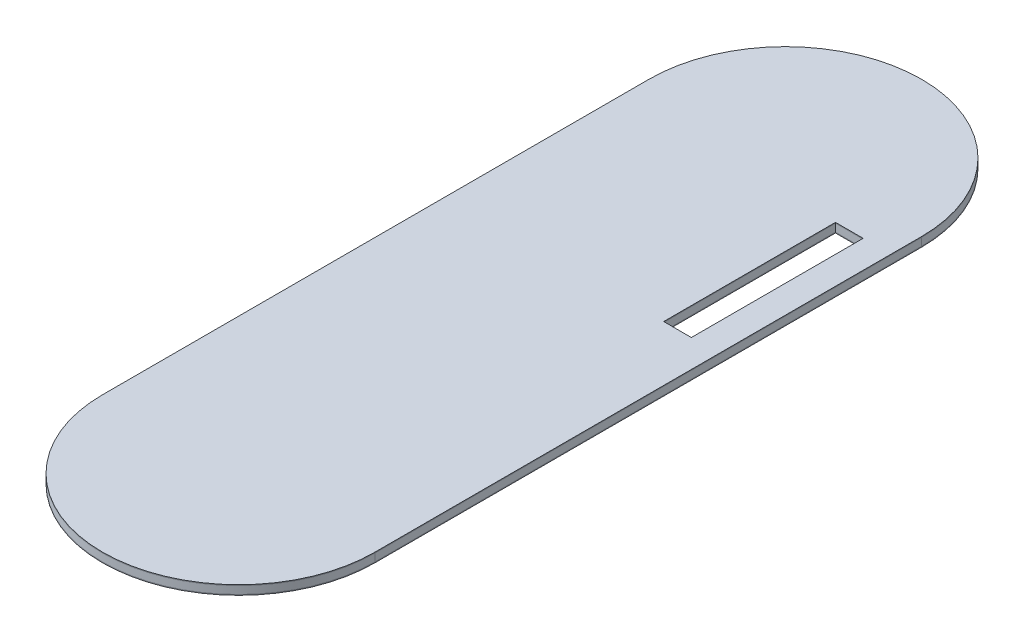
from build123d import *

# Parameters (mm, degrees)
SKETCH1_W           = 9
SKETCH1_H           = 55.88
BOSS_EXTRUDE1_DEPTH = 0.25
SKETCH2_W           = 9
SKETCH2_H           = 55.88
BOSS_EXTRUDE3_DEPTH = 2.5
SKETCH3_W           = 9
SKETCH3_H           = 55.88
BOSS_EXTRUDE4_DEPTH = 0.25


with BuildPart() as part:
    # Sketch1 → Boss-Extrude1 (new body)
    with BuildSketch(Plane(origin=(0, 0, 0), x_dir=(1, 0, 0), z_dir=(0, 1, 0))):
        with BuildLine():
            Line((44.323, 88.9), (44.323, -88.9))
            ThreePointArc((44.323, -88.9), (0, -133.223), (-44.323, -88.9))
            Line((-44.323, -88.9), (-44.323, 88.9))
            ThreePointArc((-44.323, 88.9), (0, 133.223), (44.323, 88.9))
        make_face()
        with Locations((30.823, 50.96)):
            Rectangle(SKETCH1_W, SKETCH1_H, mode=Mode.SUBTRACT)
    extrude(amount=BOSS_EXTRUDE1_DEPTH)


with BuildPart() as body_2:
    # Sketch2 → Boss-Extrude3 (new body)
    with BuildSketch(Plane(origin=(0, 0.25, 0), x_dir=(1, 0, 0), z_dir=(0, 1, 0))):
        with BuildLine():
            ThreePointArc((44.323, 88.9), (0, 133.223), (-44.323, 88.9))
            Line((-44.323, 88.9), (-44.323, -88.9))
            ThreePointArc((-44.323, -88.9), (0, -133.223), (44.323, -88.9))
            Line((44.323, -88.9), (44.323, 88.9))
        make_face()
        with Locations((30.823, 50.96)):
            Rectangle(SKETCH2_W, SKETCH2_H, mode=Mode.SUBTRACT)
    extrude(amount=BOSS_EXTRUDE3_DEPTH)


with BuildPart() as body_3:
    # Sketch3 → Boss-Extrude4 (new body)
    with BuildSketch(Plane(origin=(0, 2.75, 0), x_dir=(1, 0, 0), z_dir=(0, 1, 0))):
        with BuildLine():
            ThreePointArc((-44.323, -88.9), (0, -133.223), (44.323, -88.9))
            Line((44.323, -88.9), (44.323, 88.9))
            ThreePointArc((44.323, 88.9), (0, 133.223), (-44.323, 88.9))
            Line((-44.323, 88.9), (-44.323, -88.9))
        make_face()
        with Locations((30.823, 50.96)):
            Rectangle(SKETCH3_W, SKETCH3_H, mode=Mode.SUBTRACT)
    extrude(amount=BOSS_EXTRUDE4_DEPTH)


solid = Compound([part.part, body_2.part, body_3.part])
